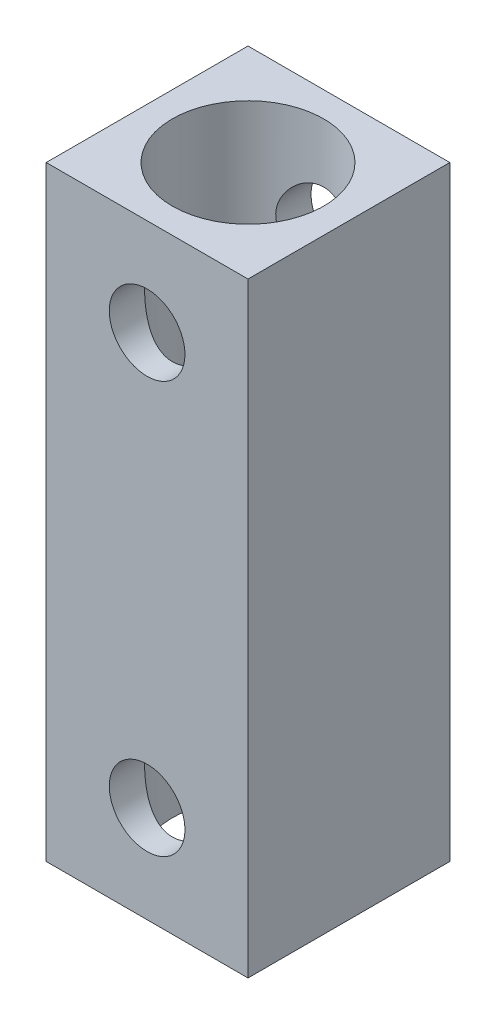
from build123d import *

# Parameters (mm, degrees)
SKETCH1_W           = 8
SKETCH1_H           = 8
SKETCH1_R           = 3
BOSS_EXTRUDE1_DEPTH = 24
SKETCH2_R           = 1.5
CUT_EXTRUDE1_DEPTH  = 26.61249695


with BuildPart() as part:
    # Sketch1 → Boss-Extrude1 (new body)
    with BuildSketch(Plane(origin=(0, 0, 0), x_dir=(1, 0, 0), z_dir=(0, 1, 0))):
        Rectangle(SKETCH1_W, SKETCH1_H)
        Circle(SKETCH1_R, mode=Mode.SUBTRACT)
    extrude(amount=BOSS_EXTRUDE1_DEPTH)

    # Sketch2 → Cut-Extrude1 (cut, through all)
    with BuildSketch(Plane(origin=(0, 0, -4), x_dir=(-1, 0, 0), z_dir=(0, 0, -1))):
        with Locations((0, 3.841258669)):
            Circle(SKETCH2_R)
        with Locations((0, 20.158741331)):
            Circle(SKETCH2_R)
    extrude(amount=-CUT_EXTRUDE1_DEPTH, mode=Mode.SUBTRACT)


solid = part.part
